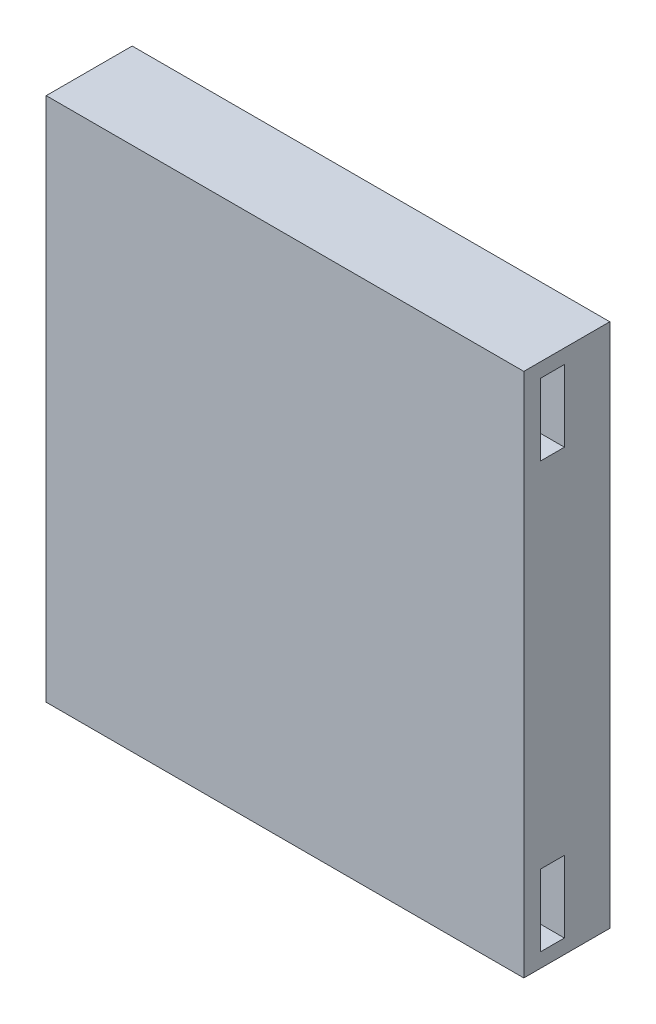
from build123d import *

# Parameters (mm, degrees)
ESBO_O1_W                = 100
ESBO_O1_H                = 110
RESSALTO_EXTRUS_O1_DEPTH = 18
ESBO_O2_W                = 18
ESBO_O2_H                = 18
RESSALTO_EXTRUS_O2_DEPTH = 10
ESBO_O3_W                = 5
ESBO_O3_H                = 15
CORTE_EXTRUS_O1_DEPTH    = 116.537872579


with BuildPart() as part:
    # Esboço1 → Ressalto-extrusão1 (new body)
    with BuildSketch(Plane.XY):
        Rectangle(ESBO_O1_W, ESBO_O1_H)
    extrude(amount=RESSALTO_EXTRUS_O1_DEPTH)

    # Esboço2 → Ressalto-extrusão2 (add)
    with BuildSketch(Plane(origin=(0, 0, 0), x_dir=(-1, 0, 0), z_dir=(0, 0, -1))):
        with Locations((-25, -25)):
            Rectangle(ESBO_O2_W, ESBO_O2_H)
        with Locations((25, -25)):
            Rectangle(ESBO_O2_W, ESBO_O2_H)
        with Locations((-25, 25)):
            Rectangle(ESBO_O2_W, ESBO_O2_H)
        with Locations((25, 25)):
            Rectangle(ESBO_O2_W, ESBO_O2_H)
    extrude(amount=RESSALTO_EXTRUS_O2_DEPTH)

    # Esboço3 → Corte-extrusão1 (cut, through all)
    with BuildSketch(Plane.ZY.offset(50)):
        with Locations((12, -44.5)):
            Rectangle(ESBO_O3_W, ESBO_O3_H)
        with Locations((12, 44.5)):
            Rectangle(ESBO_O3_W, ESBO_O3_H)
    extrude(amount=-CORTE_EXTRUS_O1_DEPTH, mode=Mode.SUBTRACT)


solid = part.part
